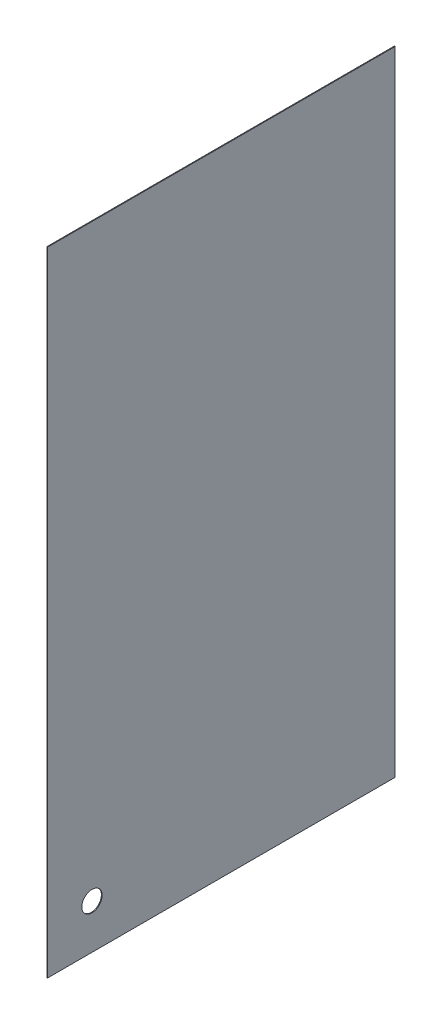
from build123d import *

# Parameters (mm, degrees)
BASEFLANGE_W       = 548
BASEFLANGE_H       = 998
BASE_FLANGE1_DEPTH = 1.2
SKETCH3_R          = 16
CUT_EXTRUDE2_DEPTH = 10


# Sheet-metal steps are written as plain solids
with BuildPart() as part:
    # BaseFlange → Base-Flange1 (new body)
    with BuildSketch(Plane(origin=(0, 0, 0), x_dir=(0, 0, -1), z_dir=(1, 0, 0))):
        with Locations((274, 499)):
            Rectangle(BASEFLANGE_W, BASEFLANGE_H)
    extrude(amount=BASE_FLANGE1_DEPTH)

    # Sketch3 → Cut-Extrude2 (cut)
    with BuildSketch(Plane(origin=(1.2, 0, 0), x_dir=(0, 0, -1), z_dir=(1, 0, 0))):
        with Locations((70, 70)):
            Circle(SKETCH3_R)
    extrude(amount=-CUT_EXTRUDE2_DEPTH, mode=Mode.SUBTRACT)


solid = part.part
